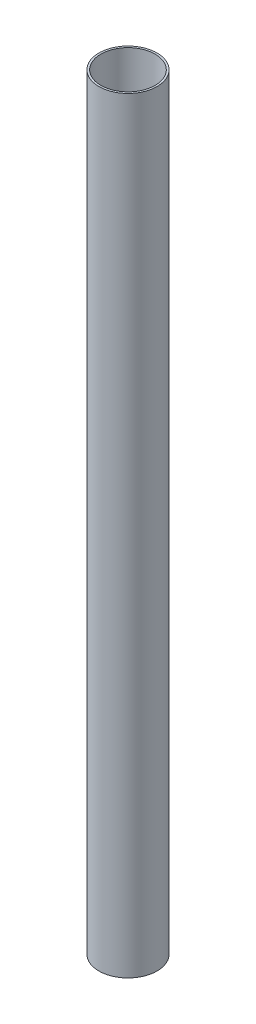
from build123d import *

# Parameters (mm, degrees)
SKETCH1_W = 1.9304
SKETCH1_H = 762


with BuildPart() as part:
    # Sketch1 → Revolve1 (revolve)
    with BuildSketch(Plane.XY):
        with Locations((27.9527, -362.838767116)):
            Rectangle(SKETCH1_W, SKETCH1_H)
    revolve(axis=Axis((0, 0, 0), (0, -1, 0)))


solid = part.part
